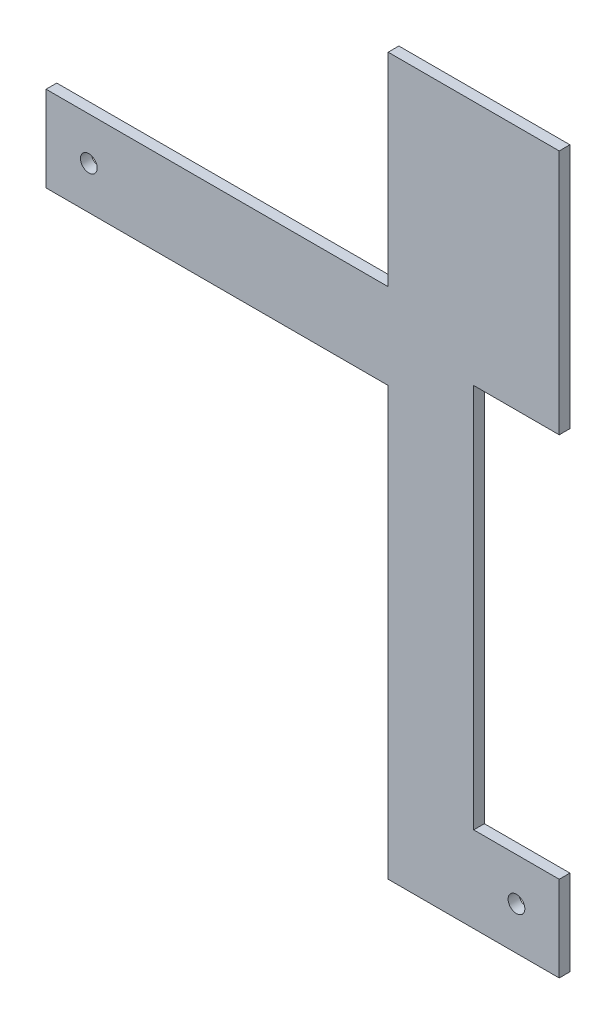
from build123d import *

# Parameters (mm, degrees)
BOSS_EXTRUDE1_DEPTH        = 3.175
F_9_0_196_DIAMETER_HOLE1_D = 4.9784


with BuildPart() as part:
    # Sketch1 → Boss-Extrude1 (new body)
    with BuildSketch(Plane(origin=(0, 0, 0), x_dir=(0, 1, 0), z_dir=(0, 0, 1))):
        Polygon((-80.9625, -12.7), (-80.9625, -38.1), (-106.3625, -38.1), (-106.3625, 12.7), (20.6375, 12.7), (20.6375, 114.3), (46.0375, 114.3), (46.0375, 12.7), (106.3625, 12.7), (106.3625, -38.1), (33.3375, -38.1), (33.3375, -12.7), align=None)
    extrude(amount=BOSS_EXTRUDE1_DEPTH)

    # #9 (0.196) Diameter Hole1 (through all)
    with Locations(Plane.XY.offset(3.175)):
        with Locations((25.4, -93.6625), (-153.251995768, -35.15541816), (-101.6, 33.3375), (-174.461563536, 15.375329004)):
            Hole(F_9_0_196_DIAMETER_HOLE1_D / 2)


solid = part.part
